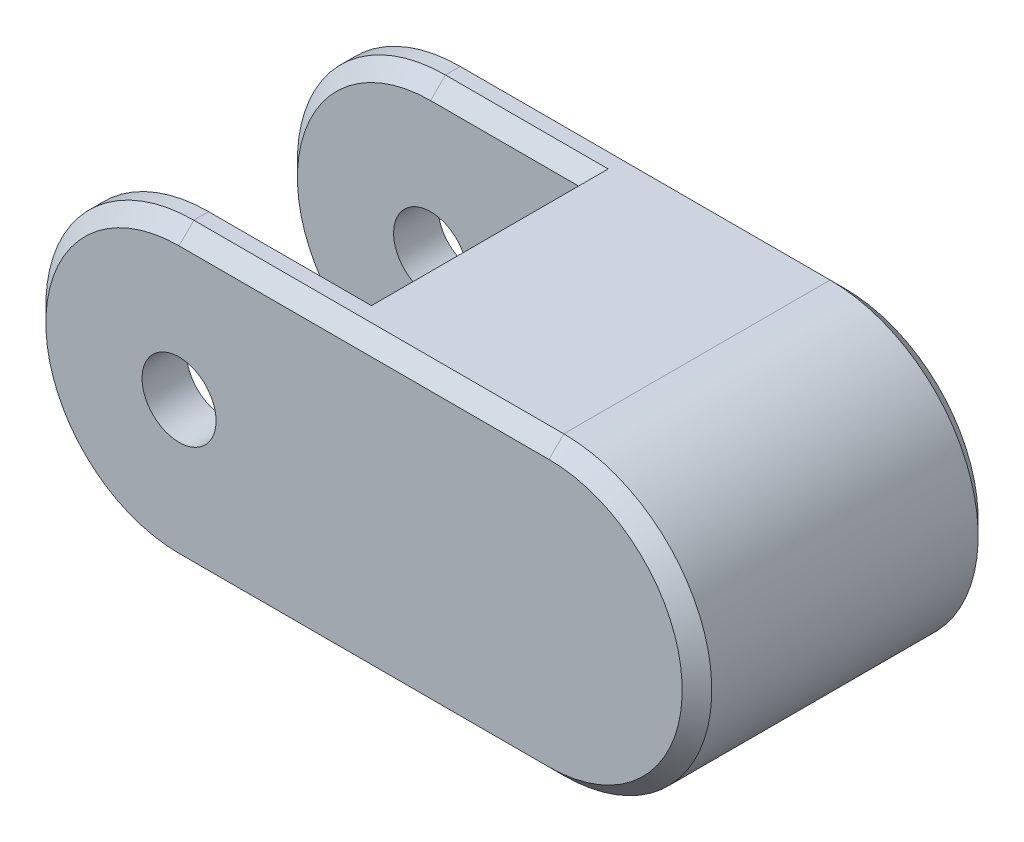
from build123d import *

# Parameters (mm, degrees)
BOSS_EXTRUDE1_DEPTH = 10
CUT_EXTRUDE1_DEPTH  = 7
CHAMFER2_SIZE       = 1
CHAMFER3_SIZE       = 1
SKETCH3_R           = 2.5
CUT_EXTRUDE2_DEPTH  = 10
SHELL2_START        = -7
SHELL2_DEPTH        = 14
CHAMFER4_SIZE       = 1


# Read off the part's stored shape, not the designer's step: Shell2
with BuildPart() as part:
    # Sketch1 → Boss-Extrude1 (new, symmetric)
    with BuildSketch(Plane.XY):
        with BuildLine():
            Line((-12.5, 10), (12.5, 10))
            ThreePointArc((12.5, 10), (22.5, 0), (12.5, -10))
            Line((12.5, -10), (-12.5, -10))
            ThreePointArc((-12.5, -10), (-22.5, 0), (-12.5, 10))
        make_face()
    extrude(amount=BOSS_EXTRUDE1_DEPTH, both=True)

    # Sketch2 → Cut-Extrude1 (cut, symmetric)
    with BuildSketch(Plane.XY):
        with BuildLine():
            Line((-12.5, 10), (-2.5, 10))
            Line((-2.5, 10), (-2.5, -10))
            Line((-2.5, -10), (-12.5, -10))
            ThreePointArc((-12.5, -10), (-22.5, 0), (-12.5, 10))
        make_face()
    extrude(amount=CUT_EXTRUDE1_DEPTH, both=True, mode=Mode.SUBTRACT)

    # Chamfer2
    chamfer2_edges = [part.edges().sort_by_distance(p)[0] for p in [
        (-22.5, 0, -7),
        (-7.5, 10, -7),
        (-7.5, -10, -7),
        (-22.5, 0, 7),
        (-7.5, -10, 7),
        (-7.5, 10, 7),
    ]]
    chamfer(chamfer2_edges, length=CHAMFER2_SIZE)

    # Chamfer3
    chamfer3_edges = [part.edges().sort_by_distance(p)[0] for p in [
        (22.5, 0, 10),
        (0, 10, 10),
        (-22.5, 0, 10),
        (0, 10, -10),
        (22.5, 0, -10),
        (0, -10, -10),
        (-22.5, 0, -10),
        (0, -10, 10),
    ]]
    chamfer(chamfer3_edges, length=CHAMFER3_SIZE)

    # Sketch3 → Cut-Extrude2 (cut, symmetric)
    with BuildSketch(Plane.XY):
        with Locations((-12.5, 0)):
            Circle(SKETCH3_R)
    extrude(amount=CUT_EXTRUDE2_DEPTH, both=True, mode=Mode.SUBTRACT)

    # Shell2 outline → Shell2 (cut)
    with BuildSketch(Plane.XY.offset(SHELL2_START)):
        with BuildLine():
            Line((12.5, 7), (-2.5, 7))
            Line((-2.5, 7), (-2.5, -7))
            Line((-2.5, -7), (12.5, -7))
            ThreePointArc((12.5, -7), (19.5, 0), (12.5, 7))
        make_face()
    extrude(amount=SHELL2_DEPTH, mode=Mode.SUBTRACT)

    # Chamfer4
    chamfer4_edges = [part.edges().sort_by_distance(p)[0] for p in [
        (-2.5, -10, 0),
        (-2.5, 10, 0),
    ]]
    chamfer(chamfer4_edges, length=CHAMFER4_SIZE)


solid = part.part
